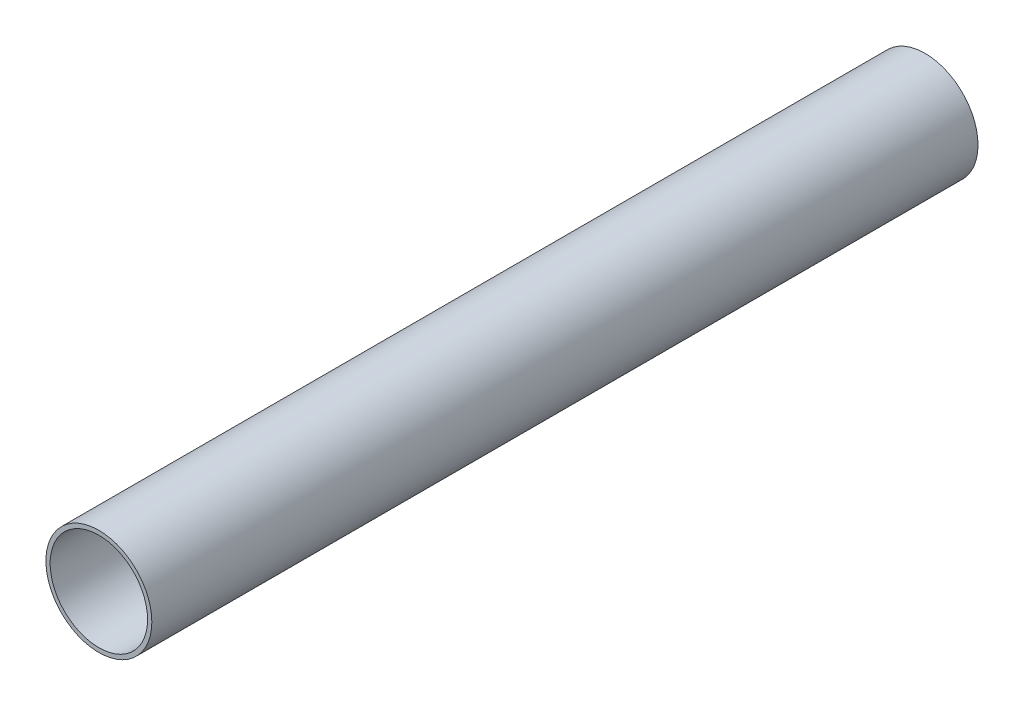
from build123d import *

# Parameters (mm, degrees)
SKETCH_1_R      = 12.5
SKETCH_1_R_2    = 11.5
EXTRUDE_1_DEPTH = 195


with BuildPart() as part:
    # 草图1 → 凸台-拉伸1 (new body)
    with BuildSketch(Plane.XY):
        Circle(SKETCH_1_R)
        Circle(SKETCH_1_R_2, mode=Mode.SUBTRACT)
    extrude(amount=EXTRUDE_1_DEPTH)


solid = part.part
